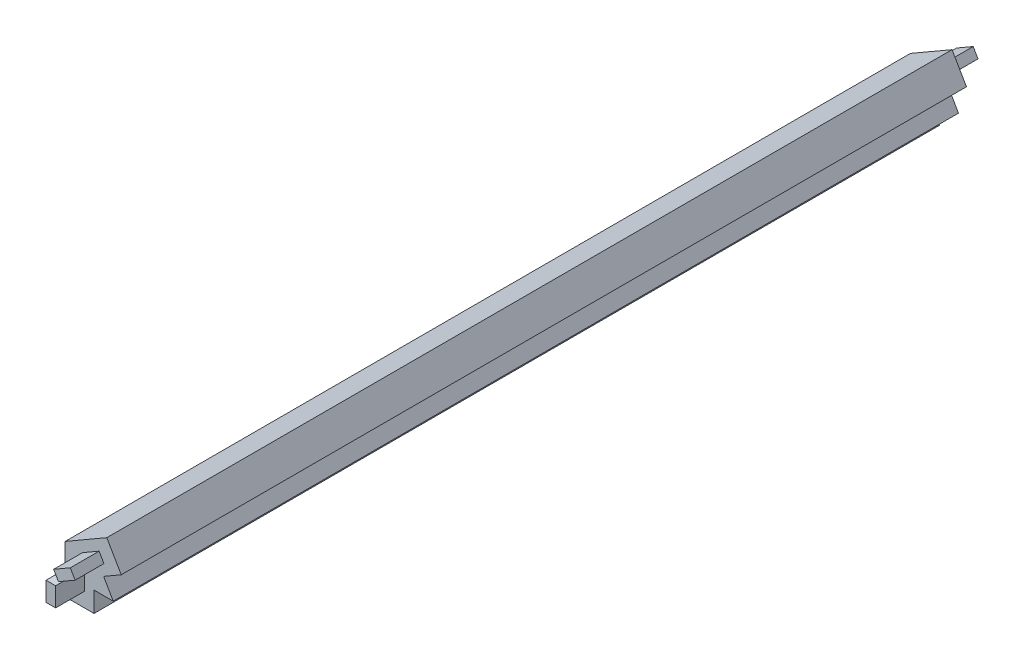
from build123d import *

# Parameters (mm, degrees)
BOSS_EXTRUDE1_DEPTH = 88
SKETCH3_W           = 2
SKETCH3_H           = 2.11
CUT_EXTRUDE1_DEPTH  = 88
CUT_EXTRUDE3_START  = -88
CUT_EXTRUDE3_DEPTH  = 88
SKETCH5_W           = 1
SKETCH5_H           = 2
BOSS_EXTRUDE2_DEPTH = 3
SKETCH6_W           = 1
SKETCH6_H           = 2
BOSS_EXTRUDE3_DEPTH = 3


# Read off the part's stored shape, not the designer's step: Cut-Extrude3
with BuildPart() as part:
    # Sketch1 → Boss-Extrude1 (new body)
    with BuildSketch(Plane.XY):
        Polygon((0, -15.964312624), (-5, -15.964312624), (-5, -10.964312624), (-0.670674615, -8.462924667), (1.830713193, -12.792250104), (0, -13.854312624), align=None)
    extrude(amount=BOSS_EXTRUDE1_DEPTH)

    # Sketch3 → Cut-Extrude1 (cut)
    with BuildSketch(Plane.XY.offset(88)):
        with Locations((-1, -14.909312624)):
            Rectangle(SKETCH3_W, SKETCH3_H)
    extrude(amount=-CUT_EXTRUDE1_DEPTH, mode=Mode.SUBTRACT)

    # Cut-Extrude3 outline → Cut-Extrude3 (cut)
    with BuildSketch(Plane.XY.offset(88).offset(CUT_EXTRUDE3_START)):
        Polygon((0.830158064, -11.060519919), (-1, -12.117944485), (0, -13.854312624), (1.830713193, -12.792250104), align=None)
    extrude(amount=CUT_EXTRUDE3_DEPTH, mode=Mode.SUBTRACT)

    # Sketch5 → Boss-Extrude2 (add)
    with BuildSketch(Plane.XY.offset(88)):
        Polygon((-3.200924793, -11.079761314), (-1.469194639, -10.079206131), (-0.968917048, -10.945071208), (-2.700647202, -11.945626391), align=None)
        with Locations((-3.5, -13.464312624)):
            Rectangle(SKETCH5_W, SKETCH5_H)
    extrude(amount=BOSS_EXTRUDE2_DEPTH)

    # Sketch6 → Boss-Extrude3 (add)
    with BuildSketch(Plane(origin=(0, 0, 0), x_dir=(-1, 0, 0), z_dir=(0, 0, -1))):
        Polygon((1.469194639, -10.079206131), (0.968917048, -10.945071208), (2.700647202, -11.945626391), (3.202395372, -11.080610981), align=None)
        with Locations((3.501951466, -13.465994689)):
            Rectangle(SKETCH6_W, SKETCH6_H)
    extrude(amount=BOSS_EXTRUDE3_DEPTH)


solid = part.part
